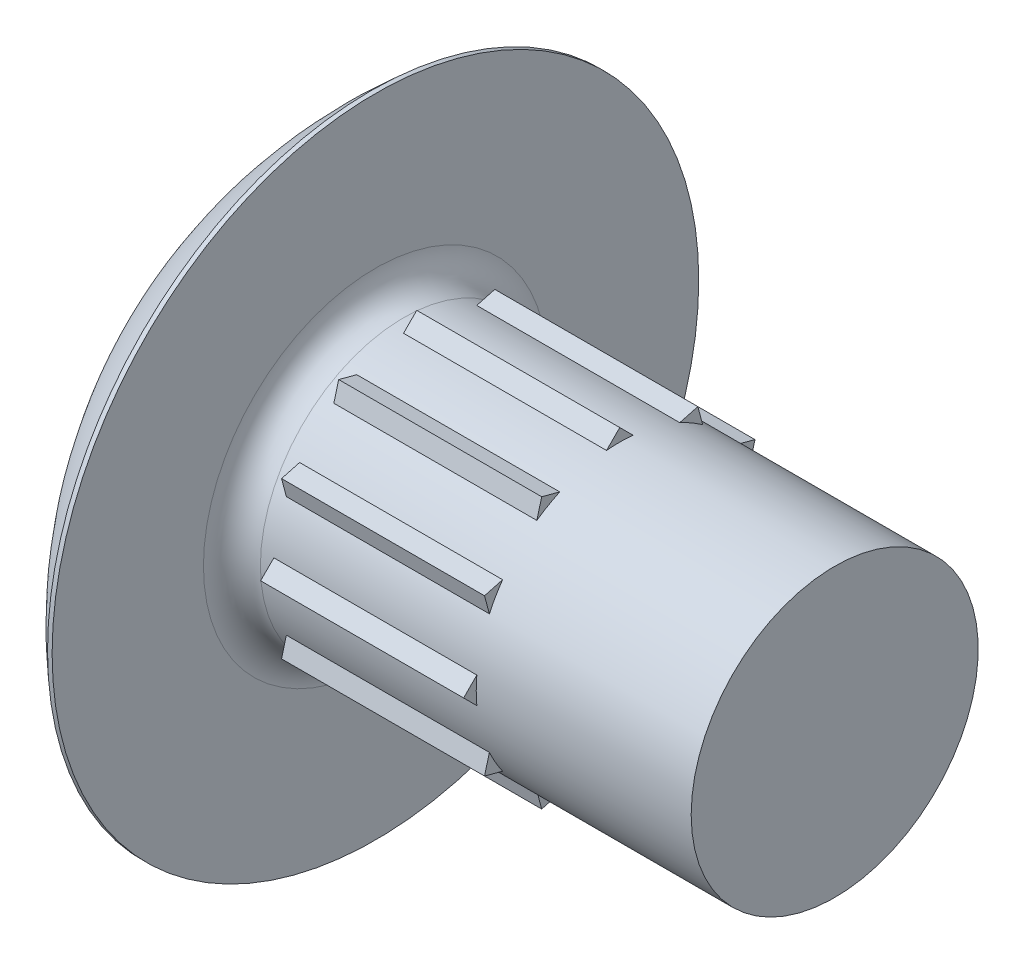
from build123d import *

# Parameters (mm, degrees)
BOSS_EXTRUDE1_DEPTH = 5.6134
CIRPATTERN1_COUNT   = 12


# Read off the part's stored shape, not the designer's step: ThreadSchematic
with BuildPart() as part:
    # ThreadSchematic outline → ThreadSchematic (revolve)
    with BuildSketch(Plane.YX):
        with BuildLine():
            Line((0, 16.9164), (0, 0))
            ThreePointArc((0, 0), (4.915818779, 1.070865158), (8.940800003, 4.089400003))
            Line((8.940800003, 4.089400003), (8.9408, 4.2164))
            Line((8.9408, 4.2164), (4.75615, 4.2164))
            ThreePointArc((4.75615, 4.2164), (4.19937412, 4.44702412), (3.96875, 5.0038))
            Line((3.96875, 5.0038), (3.96875, 16.9164))
            Line((3.96875, 16.9164), (0, 16.9164))
        make_face()
    revolve(axis=Axis((0, 0, 0), (1, 0, 0)))

    # Sketch2 → Boss-Extrude1 (add)
    with BuildSketch(Plane(origin=(5.3594, 0, 0), x_dir=(0, 0, -1), z_dir=(1, 0, 0))):
        Polygon((-4.318, 0), (-3.95182104, -0.36617896), (0, 0), (-3.95182104, 0.36617896), align=None)
    boss_extrude1 = extrude(amount=BOSS_EXTRUDE1_DEPTH)

    # CirPattern1: Boss-Extrude1 ×12 about axis
    cirpattern1_axis = Axis((0, 0, 0), (1, 0, 0))
    for i in range(1, CIRPATTERN1_COUNT):
        add(boss_extrude1.rotate(cirpattern1_axis, i * 360 / CIRPATTERN1_COUNT))


solid = part.part
